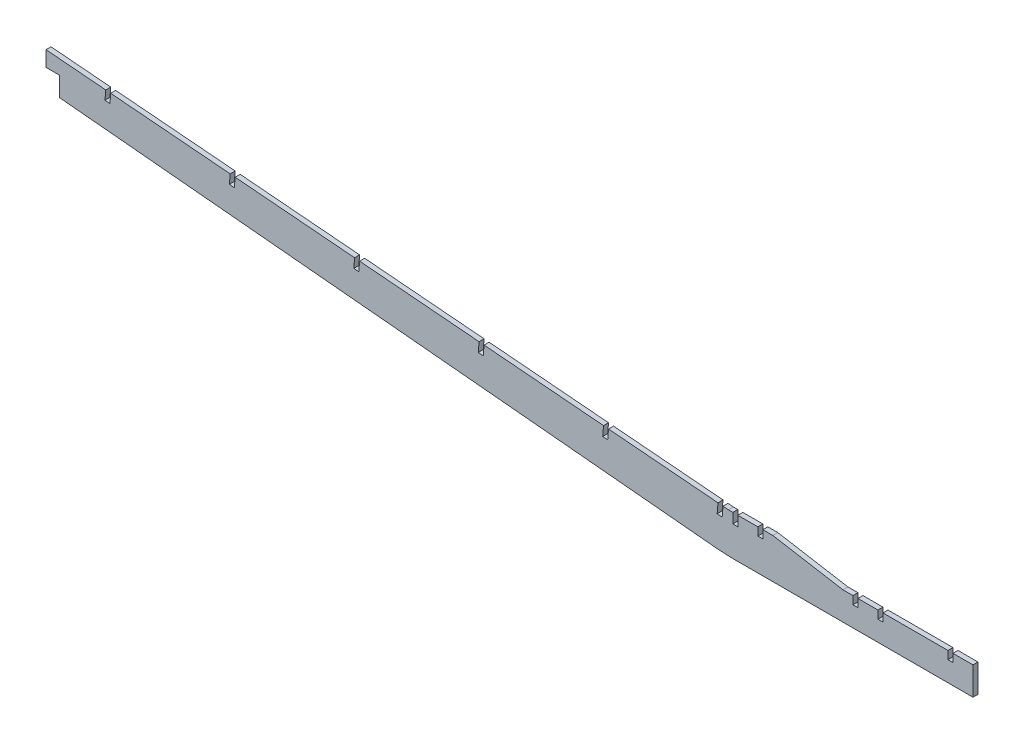
from build123d import *

# Parameters (mm, degrees)
BOSS_EXTRUDE1_DEPTH = 3.175
CUT_EXTRUDE1_DEPTH  = 955.350997373
CUT_EXTRUDE2_DEPTH  = 7.62


with BuildPart() as part:
    # Sketch1 → Boss-Extrude1 (new body)
    with BuildSketch(Plane.XY):
        Polygon((-950.530495659, 69.619322302), (-951.061849964, 63.291592645), (-11.536706102, -24.902638492), (-8.372841274, -25.168315645), (0, -25.545856054), (152.4, -25.545856054), (152.4, -7.765856054), (139.7, -7.765856054), (139.7, -12.845856054), (136.525, -12.845856054), (136.525, -7.765856054), (95.25, -7.765856054), (95.25, -12.845856054), (92.075, -12.845856054), (92.075, -7.765856054), (79.375, -7.765856054), (79.375, -12.845856054), (76.2, -12.845856054), (76.2, -7.765856054), (69.85, -7.765856054), (25.4, -0.145856054), (19.05, -0.145856054), (19.05, -5.225856054), (15.875, -5.225856054), (15.875, -0.145856054), (3.175, -0.145856054), (3.175, -6.495856054), (0, -6.495856054), (0, -0.145856054), (-2.81225704, -0.145856054), (-6.247424053, 0.14260298), (-6.778778359, -6.185126677), (-9.942643187, -5.919449524), (-9.411288881, 0.408280132), (-946.54805097, 79.101852726), (-947.366630831, 69.353645149), align=None)
    extrude(amount=BOSS_EXTRUDE1_DEPTH)

    # Sketch2 → Cut-Extrude1 (cut, through all)
    with BuildSketch(Plane.XY.offset(3.175)):
        Polygon((-79.415081651, -0.013332249), (-78.889760507, 6.242550403), (-82.053625335, 6.508227555), (-82.578671745, 0.255616625), align=None)
        Polygon((-158.378290396, 6.699631648), (-157.859826617, 12.873852131), (-161.023691445, 13.139529284), (-161.54188049, 6.968580522), align=None)
        Polygon((-237.341499142, 13.412595546), (-236.829892727, 19.50515386), (-239.993757555, 19.770831012), (-240.505089236, 13.68154442), align=None)
        Polygon((-316.304707888, 20.125559443), (-315.799958836, 26.136455588), (-318.963823664, 26.402132741), (-319.468297982, 20.394508317), align=None)
        Polygon((-395.267916634, 26.83852334), (-394.770024946, 32.767757316), (-397.933889774, 33.033434469), (-398.431506728, 27.107472214), align=None)
        Polygon((-474.23112538, 33.551487238), (-473.740091056, 39.399059045), (-476.903955884, 39.664736197), (-477.394715474, 33.820436112), align=None)
        Polygon((-553.194334126, 40.264451135), (-552.710157166, 46.030360773), (-555.874021994, 46.296037926), (-556.35792422, 40.533400009), align=None)
        Polygon((-632.157542872, 46.977415032), (-631.680223276, 52.661662502), (-634.844088104, 52.927339654), (-635.321132966, 47.246363906), align=None)
        Polygon((-711.120751618, 53.69037893), (-710.650289385, 59.29296423), (-713.814154213, 59.558641383), (-714.284341712, 53.959327804), align=None)
        Polygon((-790.083960364, 60.403342827), (-789.620355495, 65.924265958), (-792.784220323, 66.189943111), (-793.247550458, 60.672291701), align=None)
        Polygon((-869.047169109, 67.116306724), (-868.590421605, 72.555567687), (-871.754286433, 72.821244839), (-872.210759203, 67.385255598), align=None)
    extrude(amount=-CUT_EXTRUDE1_DEPTH, mode=Mode.SUBTRACT)

    # Sketch3 → Cut-Extrude2 (cut)
    with BuildSketch(Plane.XY.offset(3.175)):
        Polygon((-435.836990415, 36.216246757), (-435.836990415, 26.451619727), (-427.115588921, 26.451619727), (-427.115588921, 14.108196169), (-989.316849096, 0), (-981.213716068, 132.265755076), align=None)
    extrude(amount=-CUT_EXTRUDE2_DEPTH, mode=Mode.SUBTRACT)


solid = part.part
